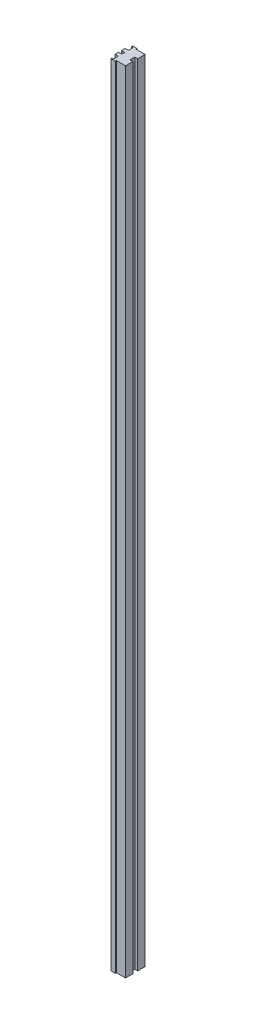
from build123d import *

# Parameters (mm, degrees)
EXTRUDE_1_DEPTH = 1200


with BuildPart() as part:
    # Эскиз1 → Бобышка-Вытянуть1 (new body)
    with BuildSketch(Plane(origin=(0, 0, 0), x_dir=(1, 0, 0), z_dir=(0, 1, 0))):
        Polygon((-13.590964358, -14.912401284), (-13.590964358, -7.678772943), (-18.647761608, -7.678772943), (-18.647761608, -2.184214078), (-13.590964358, -2.184214078), (-13.590964358, 2.184214078), (-18.647761608, 2.184214078), (-18.647761608, 7.678772943), (-13.590964358, 7.678772943), (-13.590964358, 14.912401284), (-16.119362983, 14.912401284), (-16.119362983, 16.549688043), (-9.257867683, 16.549688043), (-9.257867683, 14.912401284), (4.451377447, 14.912401284), (4.451377447, 3.685533366), (0, 3.685533366), (0, -3.685533366), (4.451377447, -3.685533366), (4.451377447, -14.912401284), (-9.257867683, -14.912401284), (-9.257867683, -16.549688043), (-16.119362983, -16.549688043), (-16.119362983, -14.912401284), align=None)
    extrude(amount=EXTRUDE_1_DEPTH)


solid = part.part
